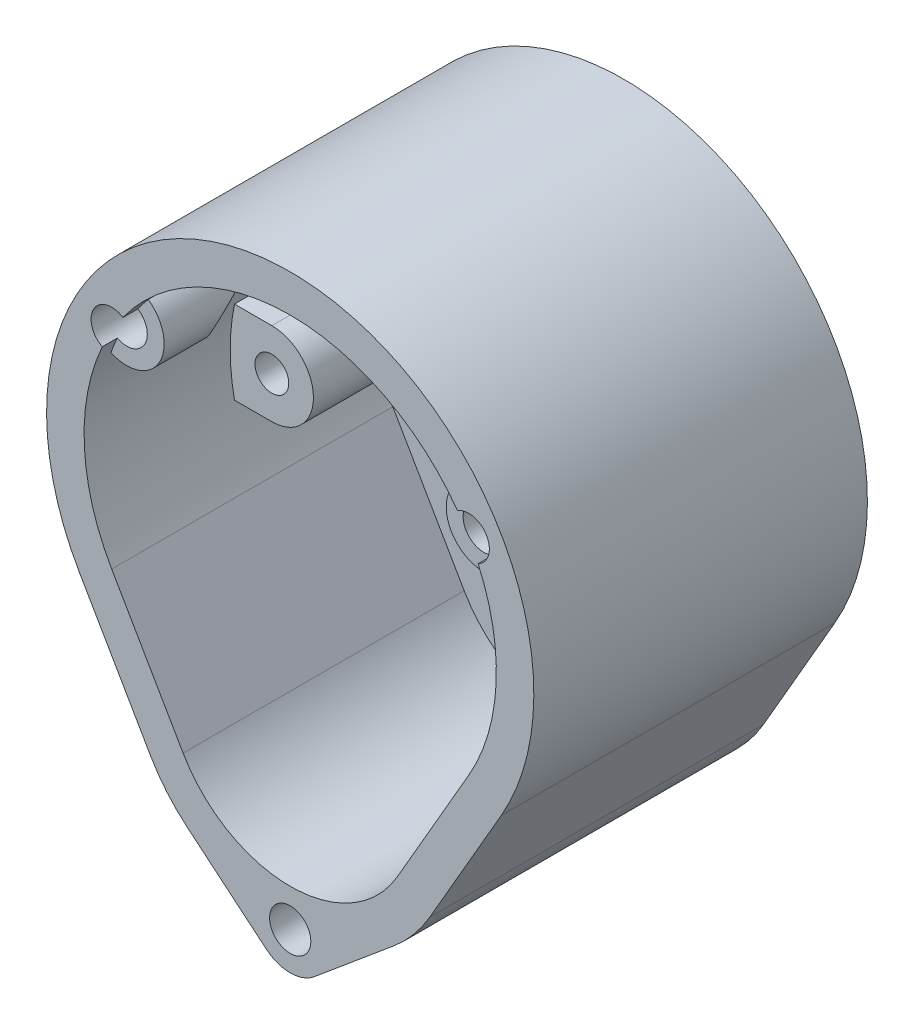
from build123d import *

# Parameters (mm, degrees)
BOSS_EXTRUDE1_DEPTH = 7
SKETCH2_R           = 2.75
CUT_EXTRUDE1_DEPTH  = 55.749429221
SKETCH3_R           = 7.1
CUT_EXTRUDE2_DEPTH  = 5
BOSS_EXTRUDE2_DEPTH = 37.5
SKETCH5_R           = 2.25
BOSS_EXTRUDE3_DEPTH = 18
CUT_EXTRUDE3_REACH  = 67.991
SKETCH6_R           = 1.6
SKETCH7_R           = 5
BOSS_EXTRUDE4_DEPTH = 17.5
CUT_REVOLVE1_ANGLE  = 90
CUT_REVOLVE2_ANGLE  = 145
CUT_EXTRUDE4_START  = -2
CUT_EXTRUDE4_DEPTH  = 2
SKETCH11_R          = 2.75
CUT_EXTRUDE6_DEPTH  = 12
CUT_EXTRUDE7_REACH  = 75.408
SKETCH12_R          = 1.5
CHAMFER1_SIZE       = 2


with BuildPart() as part:
    # Sketch1 → Boss-Extrude1 (new body)
    with BuildSketch(Plane.XY):
        with BuildLine():
            Line((-28.145825623, -16.25), (-18.619546181, -32.75))
            ThreePointArc((-18.619546181, -32.75), (0, -43.5), (18.619546181, -32.75))
            Line((18.619546181, -32.75), (28.145825623, -16.25))
            ThreePointArc((28.145825623, -16.25), (0, 32.5), (-28.145825623, -16.25))
        make_face()
    extrude(amount=BOSS_EXTRUDE1_DEPTH)

    # Sketch2 → Cut-Extrude1 (cut, through all)
    with BuildSketch(Plane.XY.offset(7)):
        with Locations((0, -22)):
            Circle(SKETCH2_R)
    extrude(amount=-CUT_EXTRUDE1_DEPTH, mode=Mode.SUBTRACT)

    # Sketch3 → Cut-Extrude2 (cut)
    with BuildSketch(Plane.XY.offset(7)):
        with Locations((0, -22)):
            Circle(SKETCH3_R)
    extrude(amount=-CUT_EXTRUDE2_DEPTH, mode=Mode.SUBTRACT)

    # Sketch4 → Boss-Extrude2 (add)
    with BuildSketch(Plane.XY.offset(7)):
        with BuildLine():
            Line((-28.145825623, -16.25), (-18.619546181, -32.75))
            ThreePointArc((-18.619546181, -32.75), (0, -43.5), (18.619546181, -32.75))
            Line((18.619546181, -32.75), (28.145825623, -16.25))
            ThreePointArc((28.145825623, -16.25), (0, 32.5), (-28.145825623, -16.25))
        make_face()
        with BuildLine():
            Line((-23.815698604, -13.75), (-14.289419162, -30.25))
            ThreePointArc((-14.289419162, -30.25), (0, -38.5), (14.289419162, -30.25))
            Line((14.289419162, -30.25), (23.815698604, -13.75))
            ThreePointArc((23.815698604, -13.75), (0, 27.5), (-23.815698604, -13.75))
        make_face(mode=Mode.SUBTRACT)
    extrude(amount=BOSS_EXTRUDE2_DEPTH)

    # Sketch5 → Boss-Extrude3 (add)
    # profile 1 of 2: a face of its own
    with BuildSketch(Plane.XY.offset(7)):
        with BuildLine():
            Line((-21.95, 5.55), (-26.93413262, 5.55))
            ThreePointArc((-26.93413262, 5.55), (-27.5, 0), (-26.93413262, -5.55))
            Line((-26.93413262, -5.55), (-21.95, -5.55))
            ThreePointArc((-21.95, -5.55), (-16.4, 0), (-21.95, 5.55))
        make_face()
        with Locations((-21.95, 0)):
            Circle(SKETCH5_R, mode=Mode.SUBTRACT)
    # profile 2 of 2: a face of its own
    with BuildSketch(Plane.XY.offset(7)):
        with BuildLine():
            Line((21.95, 5.55), (26.93413262, 5.55))
            ThreePointArc((26.93413262, 5.55), (27.5, 0), (26.93413262, -5.55))
            Line((26.93413262, -5.55), (21.95, -5.55))
            ThreePointArc((21.95, -5.55), (16.4, 0), (21.95, 5.55))
        make_face()
        with Locations((21.95, 0)):
            Circle(SKETCH5_R, mode=Mode.SUBTRACT)
    extrude(amount=BOSS_EXTRUDE3_DEPTH)

    # Sketch6 → Cut-Extrude3 (cut, up to next)
    with BuildSketch(Plane.XY.offset(7), mode=Mode.PRIVATE) as cut_extrude3_sk1:
        with Locations((-12, 15.95)):
            Circle(SKETCH6_R)
    cut_extrude3_tool1 = extrude(cut_extrude3_sk1.sketch, amount=-CUT_EXTRUDE3_REACH, mode=Mode.PRIVATE) & part.part
    # Sketch6 → Cut-Extrude3 (cut, up to next)
    with BuildSketch(Plane.XY.offset(7), mode=Mode.PRIVATE) as cut_extrude3_sk2:
        with Locations((12, 15.95)):
            Circle(SKETCH6_R)
    cut_extrude3_tool2 = extrude(cut_extrude3_sk2.sketch, amount=-CUT_EXTRUDE3_REACH, mode=Mode.PRIVATE) & part.part
    # Sketch6 → Cut-Extrude3 (cut, up to next)
    with BuildSketch(Plane.XY.offset(7), mode=Mode.PRIVATE) as cut_extrude3_sk3:
        with Locations((-12, -1.05)):
            Circle(SKETCH6_R)
    cut_extrude3_tool3 = extrude(cut_extrude3_sk3.sketch, amount=-CUT_EXTRUDE3_REACH, mode=Mode.PRIVATE) & part.part
    # Sketch6 → Cut-Extrude3 (cut, up to next)
    with BuildSketch(Plane.XY.offset(7), mode=Mode.PRIVATE) as cut_extrude3_sk4:
        with Locations((12, -1.05)):
            Circle(SKETCH6_R)
    cut_extrude3_tool4 = extrude(cut_extrude3_sk4.sketch, amount=-CUT_EXTRUDE3_REACH, mode=Mode.PRIVATE) & part.part
    add(cut_extrude3_tool1.solids().sort_by_distance((-12, 15.95, 7))[0], mode=Mode.SUBTRACT)
    add(cut_extrude3_tool2.solids().sort_by_distance((12, 15.95, 7))[0], mode=Mode.SUBTRACT)
    add(cut_extrude3_tool3.solids().sort_by_distance((-12, -1.05, 7))[0], mode=Mode.SUBTRACT)
    add(cut_extrude3_tool4.solids().sort_by_distance((12, -1.05, 7))[0], mode=Mode.SUBTRACT)

    # Sketch7 → Boss-Extrude4 (add)
    with BuildSketch(Plane.XY.offset(44.5)):
        with Locations((-23.815698604, 13.75)):
            Circle(SKETCH7_R)
        with Locations((23.815698604, 13.75)):
            Circle(SKETCH7_R)
        with BuildLine():
            Line((-13.784048752, -38.5), (-3.205592733, -47.337209302))
            ThreePointArc((-3.205592733, -47.337209302), (0, -48.5), (3.205592733, -47.337209302))
            Line((3.205592733, -47.337209302), (13.784048752, -38.5))
            ThreePointArc((13.784048752, -38.5), (0, -43.442452605), (-13.784048752, -38.5))
        make_face()
    extrude(amount=-BOSS_EXTRUDE4_DEPTH)

    # Sketch8 → Cut-Revolve1 (revolve, symmetric, cut)
    with BuildSketch(Plane(origin=(0, 0, 0), x_dir=(0, 0, -1), z_dir=(1, 0, 0))) as cut_revolve1_sk:
        Polygon((-27, -43.5), (-35.660254038, -48.5), (-27, -48.5), align=None)
    revolve(axis=Axis((0, -22, 0), (0, 0, 1)), revolution_arc=CUT_REVOLVE1_ANGLE / 2, mode=Mode.SUBTRACT)
    revolve(cut_revolve1_sk.sketch, axis=Axis((0, -22, 0), (0, 0, -1)), revolution_arc=CUT_REVOLVE1_ANGLE / 2, mode=Mode.SUBTRACT)

    # Sketch9 → Cut-Revolve2 (revolve, symmetric, cut)
    with BuildSketch(Plane(origin=(0, 0, 0), x_dir=(0, 0, -1), z_dir=(1, 0, 0))) as cut_revolve2_sk:
        Polygon((-27, 27.5), (-35.660254038, 22.5), (-27, 22.5), align=None)
    revolve(axis=Axis((0, 0, 0), (0, 0, 1)), revolution_arc=CUT_REVOLVE2_ANGLE / 2, mode=Mode.SUBTRACT)
    revolve(cut_revolve2_sk.sketch, axis=Axis((0, 0, 0), (0, 0, -1)), revolution_arc=CUT_REVOLVE2_ANGLE / 2, mode=Mode.SUBTRACT)

    # Sketch10 → Cut-Extrude4 (cut)
    with BuildSketch(Plane.XY.offset(44.5).offset(CUT_EXTRUDE4_START)):
        with BuildLine():
            Line((-23.815698604, -13.75), (-14.289419162, -30.25))
            ThreePointArc((-14.289419162, -30.25), (0, -38.5), (14.289419162, -30.25))
            Line((14.289419162, -30.25), (23.815698604, -13.75))
            ThreePointArc((23.815698604, -13.75), (0, 27.5), (-23.815698604, -13.75))
        make_face()
    extrude(amount=CUT_EXTRUDE4_DEPTH, mode=Mode.SUBTRACT)

    # Sketch11 → Cut-Extrude6 (cut)
    with BuildSketch(Plane.XY.offset(44.5)):
        with Locations((-23.815698604, 13.75)):
            Circle(SKETCH11_R)
        with Locations((23.815698604, 13.75)):
            Circle(SKETCH11_R)
        with Locations((0, -43.5)):
            Circle(SKETCH11_R)
    extrude(amount=-CUT_EXTRUDE6_DEPTH, mode=Mode.SUBTRACT)

    # Sketch12 → Cut-Extrude7 (cut, up to next)
    with BuildSketch(Plane(origin=(0, 0, 0), x_dir=(-1, 0, 0), z_dir=(0, 0, -1)), mode=Mode.PRIVATE) as cut_extrude7_sk1:
        with Locations((4.2, -33.55)):
            Circle(SKETCH12_R)
    cut_extrude7_tool1 = extrude(cut_extrude7_sk1.sketch, amount=-CUT_EXTRUDE7_REACH, mode=Mode.PRIVATE) & part.part
    # Sketch12 → Cut-Extrude7 (cut, up to next)
    with BuildSketch(Plane(origin=(0, 0, 0), x_dir=(-1, 0, 0), z_dir=(0, 0, -1)), mode=Mode.PRIVATE) as cut_extrude7_sk2:
        with Locations((-5.3, -33.55)):
            Circle(SKETCH12_R)
    cut_extrude7_tool2 = extrude(cut_extrude7_sk2.sketch, amount=-CUT_EXTRUDE7_REACH, mode=Mode.PRIVATE) & part.part
    add(cut_extrude7_tool1.solids().sort_by_distance((-4.2, -33.55, 0))[0], mode=Mode.SUBTRACT)
    add(cut_extrude7_tool2.solids().sort_by_distance((5.3, -33.55, 0))[0], mode=Mode.SUBTRACT)

    # Chamfer1
    chamfer1_edges = [part.edges().sort_by_distance(p)[0] for p in [
        (10.4, 15.95, 7),
        (10.4, -1.05, 7),
        (-13.6, -1.05, 7),
        (-13.6, 15.95, 7),
    ]]
    chamfer(chamfer1_edges, length=CHAMFER1_SIZE)


solid = part.part
